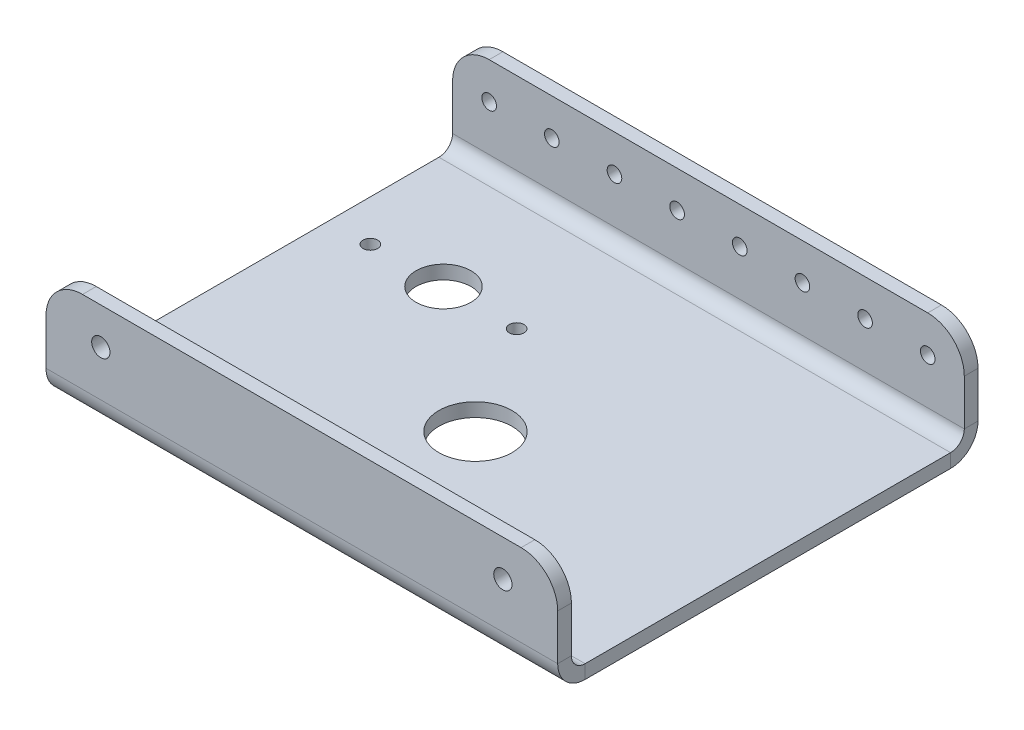
from build123d import *

# Parameters (mm, degrees)
SKETCH1_W                = 177.8
SKETCH1_H                = 127
BOSS_EXTRUDE1_DEPTH      = 3.175
CONVERT_SOLID2_START     = -88.9
CONVERT_SOLID2_OUTLINE_W = 1.5875
CONVERT_SOLID2_OUTLINE_H = 127
CONVERT_SOLID2_DEPTH     = 177.8
EDGE_FLANGE1_DEPTH       = 177.8
EDGE_FLANGE2_DEPTH       = 177.8
SKETCH17_R               = 2.54
CUT_EXTRUDE1_DEPTH       = 5.08
FILLET1_R                = 12.7
SKETCH18_R               = 3.175
CUT_EXTRUDE2_DEPTH       = 5.08
SKETCH19_R               = 12.7
CUT_EXTRUDE3_DEPTH       = 12.7
SKETCH26_R               = 9.525
CUT_EXTRUDE9_DEPTH       = 5.08
SKETCH27_R               = 2.54
CUT_EXTRUDE10_DEPTH      = 5.08
SKETCH28_R               = 2.54
CUT_EXTRUDE11_DEPTH      = 5.08


# Read off the part's stored shape, not the designer's step: Convert-Solid2
# Sheet-metal steps are written as plain solids
with BuildPart() as part:
    # Sketch1 → Boss-Extrude1 (new body)
    with BuildSketch(Plane(origin=(0, 0, 0), x_dir=(1, 0, 0), z_dir=(0, 1, 0))):
        Rectangle(SKETCH1_W, SKETCH1_H)
    extrude(amount=BOSS_EXTRUDE1_DEPTH)

    # Convert-Solid2 outline → Convert-Solid2 (add)
    with BuildSketch(Plane.YZ.offset(CONVERT_SOLID2_START)):
        with Locations((-0.79375, 0)):
            Rectangle(CONVERT_SOLID2_OUTLINE_W, CONVERT_SOLID2_OUTLINE_H)
    extrude(amount=CONVERT_SOLID2_DEPTH)

    # Edge-Flange1 section (across the edge) → Edge-Flange1 (add)
    with BuildSketch(Plane(origin=(88.9, 3.175, -68.2625), x_dir=(0, 0, 1), z_dir=(-1, 0, 0))):
        with BuildLine():
            Line((-4.7625, 4.7625), (-4.7625, 33.3375))
            Line((-4.7625, 33.3375), (0, 33.3375))
            Line((0, 33.3375), (0, 4.7625))
            ThreePointArc((0, 4.7625), (1.394903955, 1.394903955), (4.7625, 0))
            Line((4.7625, 0), (4.7625, -4.7625))
            ThreePointArc((4.7625, -4.7625), (-1.972692091, -1.972692091), (-4.7625, 4.7625))
        make_face()
    extrude(amount=EDGE_FLANGE1_DEPTH)

    # Edge-Flange2 section (across the edge) → Edge-Flange2 (add)
    with BuildSketch(Plane(origin=(-88.9, 3.175, 68.2625), x_dir=(0, 0, -1), z_dir=(1, 0, 0))):
        with BuildLine():
            Line((-4.7625, 4.7625), (-4.7625, 33.3375))
            Line((-4.7625, 33.3375), (0, 33.3375))
            Line((0, 33.3375), (0, 4.7625))
            ThreePointArc((0, 4.7625), (1.394903955, 1.394903955), (4.7625, 0))
            Line((4.7625, 0), (4.7625, -4.7625))
            ThreePointArc((4.7625, -4.7625), (-1.972692091, -1.972692091), (-4.7625, 4.7625))
        make_face()
    extrude(amount=EDGE_FLANGE2_DEPTH)

    # Sketch17 → Cut-Extrude1 (cut)
    with BuildSketch(Plane(origin=(0, 0, -73.025), x_dir=(-1, 0, 0), z_dir=(0, 0, -1))):
        with Locations(Location((-76.2, 23.8125, 0), (0, 0, 90))):
            Circle(SKETCH17_R)
        with Locations(Location((-54.428571429, 23.8125, 0), (0, 0, 90))):
            Circle(SKETCH17_R)
        with Locations(Location((-32.657142857, 23.8125, 0), (0, 0, 90))):
            Circle(SKETCH17_R)
        with Locations(Location((-10.885714286, 23.8125, 0), (0, 0, 90))):
            Circle(SKETCH17_R)
        with Locations(Location((10.885714286, 23.8125, 0), (0, 0, 90))):
            Circle(SKETCH17_R)
        with Locations(Location((32.657142857, 23.8125, 0), (0, 0, 90))):
            Circle(SKETCH17_R)
        with Locations(Location((54.428571429, 23.8125, 0), (0, 0, 90))):
            Circle(SKETCH17_R)
        with Locations(Location((76.2, 23.8125, 0), (0, 0, 90))):
            Circle(SKETCH17_R)
    extrude(amount=-CUT_EXTRUDE1_DEPTH, mode=Mode.SUBTRACT)

    # Fillet1
    fillet1_edges = [part.edges().sort_by_distance(p)[0] for p in [
        (88.9, 36.5125, -70.64375),
        (-88.9, 36.5125, -70.64375),
        (-88.9, 36.5125, 70.64375),
        (88.9, 36.5125, 70.64375),
    ]]
    fillet(fillet1_edges, radius=FILLET1_R)

    # Sketch18 → Cut-Extrude2 (cut)
    with BuildSketch(Plane(origin=(0, 0, 68.2625), x_dir=(-1, 0, 0), z_dir=(0, 0, -1))):
        with Locations((69.85, 23.8125)):
            Circle(SKETCH18_R)
        with Locations((-69.85, 23.8125)):
            Circle(SKETCH18_R)
    extrude(amount=-CUT_EXTRUDE2_DEPTH, mode=Mode.SUBTRACT)

    # Sketch19 → Cut-Extrude3 (cut)
    with BuildSketch(Plane(origin=(0, -1.5875, 0), x_dir=(-1, 0, 0), z_dir=(0, -1, 0))):
        with Locations(Location((0, -12.7, 0), (0, 0, 90))):
            Circle(SKETCH19_R)
    extrude(amount=-CUT_EXTRUDE3_DEPTH, mode=Mode.SUBTRACT)

    # Sketch26 → Cut-Extrude9 (cut)
    with BuildSketch(Plane(origin=(0, -1.5875, 0), x_dir=(-1, 0, 0), z_dir=(0, -1, 0))):
        with Locations(Location((49.203281395, 25.4, 0), (0, 0, 90))):
            Circle(SKETCH26_R)
    extrude(amount=-CUT_EXTRUDE9_DEPTH, mode=Mode.SUBTRACT)

    # Sketch27 → Cut-Extrude10 (cut)
    with BuildSketch(Plane.XZ.offset(1.5875)):
        with Locations(Location((-23.803281395, -25.4, 0), (0, 0, 270))):
            Circle(SKETCH27_R)
    extrude(amount=-CUT_EXTRUDE10_DEPTH, mode=Mode.SUBTRACT)

    # Sketch28 → Cut-Extrude11 (cut)
    with BuildSketch(Plane(origin=(0, -1.5875, 0), x_dir=(-1, 0, 0), z_dir=(0, -1, 0))):
        with Locations(Location((74.603281395, 25.4, 0), (0, 0, 90))):
            Circle(SKETCH28_R)
    extrude(amount=-CUT_EXTRUDE11_DEPTH, mode=Mode.SUBTRACT)


solid = part.part
